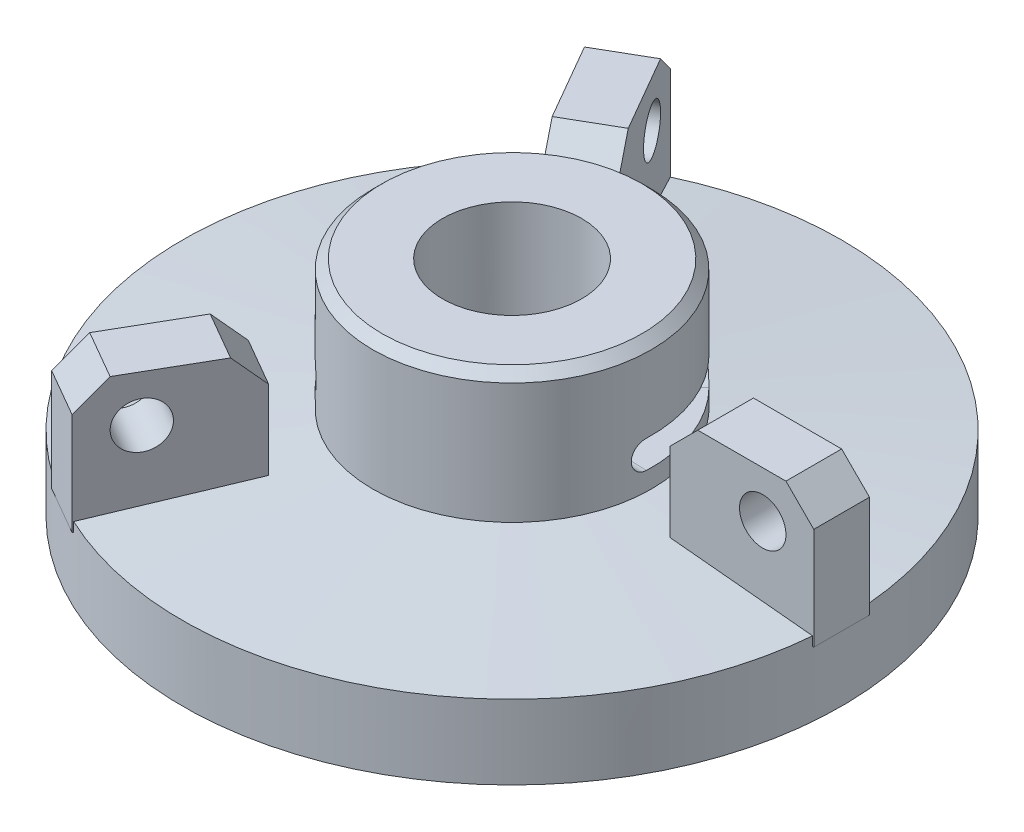
from build123d import *

# Parameters (mm, degrees)
SKETCH2_W           = 15.5
SKETCH2_H           = 14
BOSS_EXTRUDE1_DEPTH = 3
CIRPATTERN1_COUNT   = 3
CUT_EXTRUDE1_DEPTH  = 12
CUT_EXTRUDE2_START  = -9
CUT_EXTRUDE2_DEPTH  = 3
CUT_EXTRUDE3_REACH  = 60.279
SKETCH6_R           = 2.5
CIRPATTERN2_COUNT   = 3
FILLET1_R           = 1.5
CHAMFER1_SIZE       = 3
CHAMFER2_SIZE       = 1


with BuildPart() as part:
    # Sketch1 → Revolve1 (revolve)
    with BuildSketch(Plane.XY, mode=Mode.PRIVATE) as revolve1_sk:
        Polygon((0, 0), (35.5, 0), (35.5, 8), (15, 9.999206161), (15, 24), (0, 24), align=None)
    revolve(revolve1_sk.sketch.rotate(Axis((0, -5.176379432, 0), (0, 1, 0)), 90), axis=Axis((0, -5.176379432, 0), (0, 1, 0)))

    # Sketch2 → Boss-Extrude1 (add, symmetric)
    with BuildSketch(Plane.XY):
        with Locations((27.75, 14)):
            Rectangle(SKETCH2_W, SKETCH2_H)
    boss_extrude1 = extrude(amount=BOSS_EXTRUDE1_DEPTH, both=True)

    # CirPattern1: Boss-Extrude1 ×3 about axis
    cirpattern1_axis = Axis((0, 0, 0), (0, 1, 0))
    for i in range(1, CIRPATTERN1_COUNT):
        add(boss_extrude1.rotate(cirpattern1_axis, i * 360 / CIRPATTERN1_COUNT))

    # Sketch3 → Cut-Revolve1 (revolve, cut)
    with BuildSketch(Plane.XY, mode=Mode.PRIVATE) as cut_revolve1_sk:
        Polygon((0, 0), (22.5, 0), (22.5, 3), (7.5, 3), (7.5, 24), (0, 24), align=None)
    revolve(cut_revolve1_sk.sketch.rotate(Axis((0, -2.419018625, 0), (0, 1, 0)), 90), axis=Axis((0, -2.419018625, 0), (0, 1, 0)), mode=Mode.SUBTRACT)

    # Sketch4 → Cut-Extrude1 (cut)
    with BuildSketch(Plane.XZ.offset(-3)):
        with BuildLine():
            Line((-6.363961031, 8.485281374), (8.485281374, -6.363961031))
            ThreePointArc((8.485281374, -6.363961031), (8.485281374, -8.485281374), (6.363961031, -8.485281374))
            Line((6.363961031, -8.485281374), (-8.485281374, 6.363961031))
            ThreePointArc((-8.485281374, 6.363961031), (-8.485281374, 8.485281374), (-6.363961031, 8.485281374))
        make_face()
    extrude(amount=-CUT_EXTRUDE1_DEPTH, mode=Mode.SUBTRACT)

    # Sketch5 → Cut-Extrude2 (cut)
    with BuildSketch(Plane(origin=(0, 24, 0), x_dir=(1, 0, 0), z_dir=(0, 1, 0)).offset(CUT_EXTRUDE2_START)):
        with BuildLine():
            Line((9.492775288, 11.614095631), (4.135492251, 6.256812594))
            ThreePointArc((4.135492251, 6.256812594), (6.97813176, 2.7487592), (7.291643494, -1.755544118))
            Line((7.291643494, -1.755544118), (14.86337052, -2.019954652))
            ThreePointArc((14.86337052, -2.019954652), (13.95626352, 5.497518401), (9.492775288, 11.614095631))
        make_face()
        with BuildLine():
            Line((-4.135492251, -6.256812594), (-9.492775288, -11.614095631))
            ThreePointArc((-9.492775288, -11.614095631), (-13.95626352, -5.497518401), (-14.86337052, 2.019954652))
            Line((-14.86337052, 2.019954652), (-7.291643494, 1.755544118))
            ThreePointArc((-7.291643494, 1.755544118), (-6.97813176, -2.7487592), (-4.135492251, -6.256812594))
        make_face()
    extrude(amount=-CUT_EXTRUDE2_DEPTH, mode=Mode.SUBTRACT)

    # Sketch6 → Cut-Extrude3 (cut, up to next)
    with BuildSketch(Plane(origin=(-2.598076211, 0, -1.5), x_dir=(0.500000000000004, 0, -0.8660254037844364), z_dir=(0.8660254037844365, 0, 0.500000000000004)), mode=Mode.PRIVATE) as cut_extrude3_sk1:
        with Locations(Location((-30, 16, 0), (0, 0, 180))):
            Circle(SKETCH6_R)
    cut_extrude3_tool1 = extrude(cut_extrude3_sk1.sketch, amount=CUT_EXTRUDE3_REACH, mode=Mode.PRIVATE) & part.part
    cut_extrude3 = cut_extrude3_tool1.solids().sort_by_distance((-17.598076, 16, 24.480762))[0]
    add(cut_extrude3, mode=Mode.SUBTRACT)

    # CirPattern2: Cut-Extrude3 ×3 about axis
    cirpattern2_axis = Axis((0, -5.176379432, 0), (0, -1, 0))
    for i in range(1, CIRPATTERN2_COUNT):
        add(cut_extrude3.rotate(cirpattern2_axis, i * 360 / CIRPATTERN2_COUNT), mode=Mode.SUBTRACT)

    # Fillet1
    fillet1_edges = [part.edges().sort_by_distance(p)[0] for p in [
        (11.077507007, 15, 1.887749385),
        (11.077507007, 12, 1.887749385),
        (6.814133769, 15, -8.935454113),
        (7.928368159, 12, -10.049688503),
        (-6.814133769, 15, 8.935454113),
        (-7.928368159, 12, 10.049688503),
        (-11.077507007, 15, -1.887749385),
        (-11.077507007, 12, -1.887749385),
    ]]
    fillet(fillet1_edges, radius=FILLET1_R - 0.0001)  # a hair under: the kernel refuses the full size

    # Chamfer1
    chamfer1_edges = [part.edges().sort_by_distance(p)[0] for p in [
        (35.5, 21, 0),
        (20, 21, 0),
        (-17.75, 21, 30.743901834),
        (-10, 21, 17.320508076),
        (-17.75, 21, -30.743901834),
        (-10, 21, -17.320508076),
    ]]
    chamfer(chamfer1_edges, length=CHAMFER1_SIZE)

    # Chamfer2
    chamfer2_edges = [part.edges().sort_by_distance(p)[0] for p in [
        (0, 24, 15),
    ]]
    chamfer(chamfer2_edges, length=CHAMFER2_SIZE)


solid = part.part
